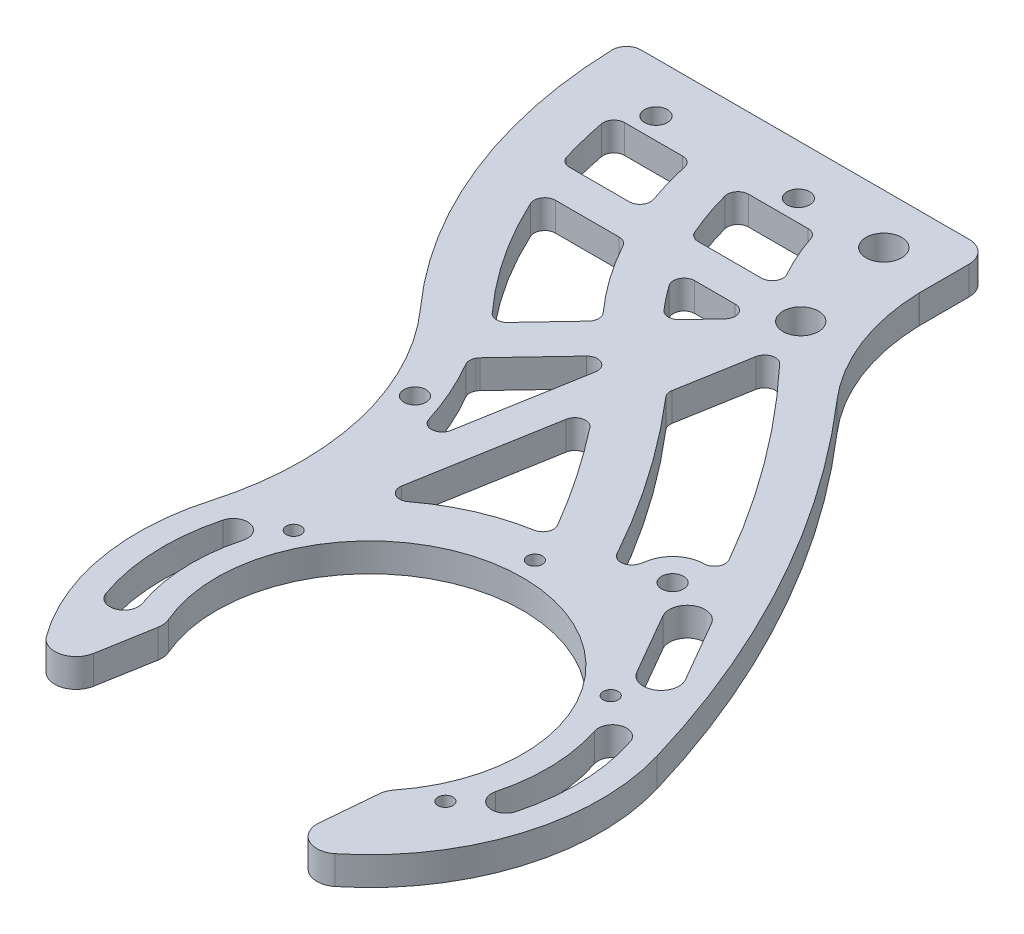
from build123d import *

# Parameters (mm, degrees)
SKETCH_1_W           = 52
SKETCH_1_H           = 10
EXTRUDE_1_DEPTH      = 4
SKETCH_2_R           = 1.6
CUT_EXTRUDE_1_DEPTH  = 4
EXTRUDE_3_DEPTH      = 4
SKETCH_4_R           = 21.5
CUT_EXTRUDE_2_DEPTH  = 4
SKETCH_5_R           = 1.05
CUT_EXTRUDE_3_DEPTH  = 4
CUT_EXTRUDE_4_DEPTH  = 10
CUT_EXTRUDE_5_DEPTH  = 10
CUT_EXTRUDE_6_DEPTH  = 10
EXTRUDE_START        = -4
SKETCH_11_R          = 4.5
EXTRUDE_4_DEPTH      = 4
SKETCH_12_R          = 1.55
CUT_EXTRUDE_7_DEPTH  = 4
CUT_EXTRUDE_9_DEPTH  = 10
FILLET_5_R           = 3
SKETCH_15_R          = 1.55
CUT_EXTRUDE_10_DEPTH = 10
CUT_EXTRUDE_11_DEPTH = 4
FILLET_6_R           = 1.5
SKETCH_18_R          = 2.5
SKETCH_18_R_2        = 1.6
CUT_EXTRUDE_12_DEPTH = 4
CUT_EXTRUDE_START    = -4
CUT_EXTRUDE_13_DEPTH = 4
FILLET_7_R           = 2


# Read off the part's stored shape, not the designer's step: 切除-拉伸13
with BuildPart() as part:
    # 草图1 → 凸台-拉伸1 (new body)
    with BuildSketch(Plane(origin=(0, 0, 0), x_dir=(1, 0, 0), z_dir=(0, 1, 0))):
        Rectangle(SKETCH_1_W, SKETCH_1_H)
    extrude(amount=EXTRUDE_1_DEPTH)

    # 草图2 → 切除-拉伸1 (cut)
    with BuildSketch(Plane(origin=(0, 4, 0), x_dir=(1, 0, 0), z_dir=(0, 1, 0))):
        with Locations(Location((-14, -2, 0), (0, 0, 270))):
            Circle(SKETCH_2_R)
        with Locations(Location((6, -2, 0), (0, 0, 270))):
            Circle(SKETCH_2_R)
    extrude(amount=-CUT_EXTRUDE_1_DEPTH, mode=Mode.SUBTRACT)

    # 草图3 → 凸台-拉伸3 (add)
    with BuildSketch(Plane(origin=(0, 4, 0), x_dir=(1, 0, 0), z_dir=(0, 1, 0))):
        with BuildLine():
            ThreePointArc((1.521813045, -80.036664835), (32.882226801, -121.499775209), (63.933346813, -79.804535446))
            ThreePointArc((63.933346813, -79.804535446), (51.636617213, -50.215459979), (33.335884345, -23.913252421))
            ThreePointArc((33.335884345, -23.913252421), (28.020789941, -15.095507245), (26, -5))
            Line((26, -5), (-26, -5))
            ThreePointArc((-26, -5), (-23.512302629, -22.658936218), (-12.646779094, -36.799907362))
            ThreePointArc((-12.646779094, -36.799907362), (1.078545586, -56.242035351), (1.521813045, -80.036664835))
        make_face()
    extrude(amount=-EXTRUDE_3_DEPTH)

    # 草图4 → 切除-拉伸2 (cut)
    with BuildSketch(Plane(origin=(0, 4, 0), x_dir=(1, 0, 0), z_dir=(0, 1, 0))):
        with Locations(Location((32.761349256, -89, 0), (0, 0, 270))):
            Circle(SKETCH_4_R)
    extrude(amount=-CUT_EXTRUDE_2_DEPTH, mode=Mode.SUBTRACT)

    # 草图5 → 切除-拉伸3 (cut)
    with BuildSketch(Plane.XZ):
        with Locations(Location((31.515544041, 64.531694596, 0), (0, 0, 270))):
            Circle(SKETCH_5_R)
        with Locations(Location((10.948272581, 77.844746262, 0), (0, 0, 270))):
            Circle(SKETCH_5_R)
        with Locations(Location((12.194077796, 102.313051667, 0), (0, 0, 270))):
            Circle(SKETCH_5_R)
        with Locations(Location((34.007154472, 113.468305404, 0), (0, 0, 270))):
            Circle(SKETCH_5_R)
        with Locations(Location((54.574425932, 100.155253738, 0), (0, 0, 270))):
            Circle(SKETCH_5_R)
        with Locations(Location((53.328620717, 75.686948333, 0), (0, 0, 270))):
            Circle(SKETCH_5_R)
    extrude(amount=-CUT_EXTRUDE_3_DEPTH, mode=Mode.SUBTRACT)

    # 草图8 → 切除-拉伸4 (cut)
    with BuildSketch(Plane(origin=(0, 4, 0), x_dir=(1, 0, 0), z_dir=(0, 1, 0))):
        with BuildLine():
            Line((45.98329313, -118.688890181), (48.203895401, -103.959203474))
            ThreePointArc((48.203895401, -103.959203474), (29.304772302, -110.220322235), (13.369657115, -98.285056591))
            Line((13.369657115, -98.285056591), (10.800862536, -112.958026275))
            ThreePointArc((10.800862536, -112.958026275), (27.53629107, -121.077231286), (45.98329313, -118.688890181))
        make_face()
    extrude(amount=-CUT_EXTRUDE_4_DEPTH, mode=Mode.SUBTRACT)

    # 草图9 → 切除-拉伸5 (cut)
    with BuildSketch(Plane(origin=(0, 4, 0), x_dir=(1, 0, 0), z_dir=(0, 1, 0))):
        with BuildLine():
            ThreePointArc((2.261304319, -44.591253126), (6.28220686, -52.93399338), (8.570902162, -61.907891418))
            Line((8.570902162, -61.907891418), (13.726418113, -32.459554104))
            Line((13.726418113, -32.459554104), (2.261304319, -44.591253126))
        make_face()
        with BuildLine():
            ThreePointArc((-4.036224589, -12.304585463), (-5.165941762, -8.688618892), (-6.029403289, -5))
            Line((-6.029403289, -5), (-17.20128616, -5))
            ThreePointArc((-17.20128616, -5), (-16.390165734, -9.150885172), (-15.302367858, -13.237994154))
            ThreePointArc((-15.302367858, -13.237994154), (-14.76064503, -14.008197341), (-13.866597194, -14.303756198))
            Line((-13.866597194, -14.303756198), (-5.450731068, -14.303756198))
            ThreePointArc((-5.450731068, -14.303756198), (-4.226240132, -13.67014061), (-4.036224589, -12.304585463))
        make_face()
        with BuildLine():
            ThreePointArc((13.136599911, -14.303756198), (13.910931188, -14.088439455), (14.462960482, -13.504304294))
            ThreePointArc((14.462960482, -13.504304294), (14.636495421, -12.786051458), (14.446054709, -12.072094984))
            ThreePointArc((14.446054709, -12.072094984), (12.758027899, -8.618194999), (11.458980338, -5))
            Line((11.458980338, -5), (0.100111359, -5))
            ThreePointArc((0.100111359, -5), (1.268714012, -9.267958013), (2.841998417, -13.403882811))
            ThreePointArc((2.841998417, -13.403882811), (3.395189817, -14.05878407), (4.21671586, -14.303756198))
            Line((4.21671586, -14.303756198), (13.136599911, -14.303756198))
        make_face()
        with BuildLine():
            ThreePointArc((29.973452999, -60.636685059), (23.981149414, -50.992543614), (17.145000635, -41.926991433))
            Line((17.145000635, -41.926991433), (12.394033631, -69.064542789))
            ThreePointArc((12.394033631, -69.064542789), (20.440709832, -63.300742342), (29.973452999, -60.636685059))
        make_face()
        with BuildLine():
            ThreePointArc((35.754959969, -56.638166076), (38.556099012, -57.020774317), (41.313388497, -57.645373151))
            Line((41.313388497, -57.645373151), (46.097332926, -52.594274703))
            ThreePointArc((46.097332926, -52.594274703), (35.503275522, -36.166992281), (22.782062805, -21.325819581))
            Line((22.782062805, -21.325819581), (20.398205396, -34.942427066))
            ThreePointArc((20.398205396, -34.942427066), (28.619942986, -45.405693363), (35.754959969, -56.638166076))
        make_face()
        with BuildLine():
            ThreePointArc((15.512644471, -21.834042827), (15.80003242, -20.21022016), (14.422456661, -19.303756198))
            Line((14.422456661, -19.303756198), (8.745122175, -19.303756198))
            ThreePointArc((8.745122175, -19.303756198), (7.411952212, -20.116255035), (7.523047642, -21.673545732))
            ThreePointArc((7.523047642, -21.673545732), (8.814595067, -23.40099417), (10.185698616, -25.06600105))
            ThreePointArc((10.185698616, -25.06600105), (10.740014236, -25.468525591), (11.415497527, -25.582605109))
            ThreePointArc((11.415497527, -25.582605109), (11.95762664, -25.443763133), (12.411135384, -25.115874602))
            Line((12.411135384, -25.115874602), (15.512644471, -21.834042827))
        make_face()
        with BuildLine():
            ThreePointArc((-1.506377954, -37.498903628), (-0.411648069, -37.986972344), (0.691104569, -37.5173116))
            Line((0.691104569, -37.5173116), (6.202954756, -31.685000754))
            ThreePointArc((6.202954756, -31.685000754), (6.612622783, -30.675510032), (6.231100583, -29.655049243))
            ThreePointArc((6.231100583, -29.655049243), (2.568643561, -25.059607296), (-0.551939961, -20.080286398))
            ThreePointArc((-0.551939961, -20.080286398), (-1.102788408, -19.512399411), (-1.865938229, -19.303756198))
            Line((-1.865938229, -19.303756198), (-10.824870498, -19.303756198))
            ThreePointArc((-10.824870498, -19.303756198), (-12.088603037, -19.995684376), (-12.186452705, -21.433116105))
            ThreePointArc((-12.186452705, -21.433116105), (-7.465018486, -29.877239502), (-1.506377954, -37.498903628))
        make_face()
    extrude(amount=-CUT_EXTRUDE_5_DEPTH, mode=Mode.SUBTRACT)

    # 草图10 → 切除-拉伸6 (cut)
    with BuildSketch(Plane(origin=(0, 4, 0), x_dir=(1, 0, 0), z_dir=(0, 1, 0))):
        with BuildLine():
            ThreePointArc((-26, -5), (-21.816679344, -21.010216482), (-14.074474337, -35.635040075))
            ThreePointArc((-14.074474337, -35.635040075), (-23.857818501, -21.80478562), (-26, -5))
        make_face()
    extrude(amount=-CUT_EXTRUDE_6_DEPTH, mode=Mode.SUBTRACT)

    # 草图11 → 凸台-拉伸4 (add)
    with BuildSketch(Plane(origin=(0, 4, 0), x_dir=(1, 0, 0), z_dir=(0, 1, 0)).offset(EXTRUDE_START)):
        with Locations((43.923502836, -57.591644213)):
            Circle(SKETCH_11_R)
        with BuildLine():
            Line((12.488002369, -103.321073663), (12.812973446, -101.464836968))
            ThreePointArc((12.812973446, -101.464836968), (11.159808075, -102.131982223), (12.488002369, -103.321073663))
        make_face()
    extrude(amount=EXTRUDE_4_DEPTH)

    # 草图12 → 切除-拉伸7 (cut)
    with BuildSketch(Plane(origin=(0, 4, 0), x_dir=(1, 0, 0), z_dir=(0, 1, 0))):
        with Locations(Location((43.923502836, -57.591644213, 0), (0, 0, 270))):
            Circle(SKETCH_12_R)
    extrude(amount=-CUT_EXTRUDE_7_DEPTH, mode=Mode.SUBTRACT)

    # 草图14 → 切除-拉伸9 (cut)
    with BuildSketch(Plane(origin=(0, 4, 0), x_dir=(1, 0, 0), z_dir=(0, 1, 0))):
        with BuildLine():
            Line((47.77758134, -117.822955678), (49.091476898, -102.984882238))
            ThreePointArc((49.091476898, -102.984882238), (48.655153878, -103.478845764), (48.203895401, -103.959203474))
            Line((48.203895401, -103.959203474), (45.98329313, -118.688890181))
            ThreePointArc((45.98329313, -118.688890181), (46.887074229, -118.269675331), (47.77758134, -117.822955678))
        make_face()
    extrude(amount=-CUT_EXTRUDE_9_DEPTH, mode=Mode.SUBTRACT)

    # 圆角5
    fillet_5_edges = [part.edges().sort_by_distance(p)[0] for p in [
        (-14.074474337, 2, 35.635040075),
        (49.091476898, 2, 102.984882238),
        (47.77758134, 2, 117.822955678),
        (26, 2, 5),
        (-26, 2, 5),
        (-26, 2, -5),
        (26, 2, -5),
        (13.369657115, 2, 98.285056591),
        (10.800862536, 2, 112.958026275),
    ]]
    fillet(fillet_5_edges, radius=FILLET_5_R)

    # 草图15 → 切除-拉伸10 (cut)
    with BuildSketch(Plane(origin=(0, 4, 0), x_dir=(1, 0, 0), z_dir=(0, 1, 0))):
        with Locations(Location((3.122228964, -52.979654288, 0), (0, 0, 270))):
            Circle(SKETCH_15_R)
    extrude(amount=-CUT_EXTRUDE_10_DEPTH, mode=Mode.SUBTRACT)

    # 草图17 → 切除-拉伸11 (cut)
    with BuildSketch(Plane(origin=(0, 4, 0), x_dir=(1, 0, 0), z_dir=(0, 1, 0))):
        with BuildLine():
            Line((47.299544417, -62.334301422), (52.299544417, -70.99455546))
            ThreePointArc((52.299544417, -70.99455546), (55.714607926, -71.909618969), (56.629671436, -68.49455546))
            Line((56.629671436, -68.49455546), (51.629671436, -59.834301422))
            ThreePointArc((51.629671436, -59.834301422), (48.214607926, -58.919237913), (47.299544417, -62.334301422))
        make_face()
        with BuildLine():
            Line((39.44111887, -57.193857859), (38.127043054, -61.009656485))
            ThreePointArc((38.127043054, -61.009656485), (36.961437554, -58.812822159), (35.754959969, -56.638166076))
            ThreePointArc((35.754959969, -56.638166076), (37.606013339, -56.863117296), (39.44111887, -57.193857859))
        make_face()
        with BuildLine():
            ThreePointArc((47.059341861, -54.364181803), (46.282476668, -53.759511326), (45.39271321, -53.338243118))
            Line((45.39271321, -53.338243118), (46.097332926, -52.594274703))
            ThreePointArc((46.097332926, -52.594274703), (46.581432397, -53.477546007), (47.059341861, -54.364181803))
        make_face()
    extrude(amount=-CUT_EXTRUDE_11_DEPTH, mode=Mode.SUBTRACT)

    # 圆角6
    fillet_6_edges = [part.edges().sort_by_distance(p)[0] for p in [
        (0.100111359, 2, 5),
        (11.458980338, 2, 5),
        (-6.029403289, 2, 5),
        (-17.20128616, 2, 5),
        (12.394033631, 2, 69.064542789),
        (17.145000635, 2, 41.926991433),
        (29.973452999, 2, 60.636685059),
        (8.570902162, 2, 61.907891418),
        (2.261304319, 2, 44.591253126),
        (13.726418113, 2, 32.459554104),
        (20.398205396, 2, 34.942427066),
        (22.782062805, 2, 21.325819581),
        (39.44111887, 2, 57.193857859),
        (47.059341861, 2, 54.364181803),
        (38.127043054, 2, 61.009656485),
    ]]
    fillet(fillet_6_edges, radius=FILLET_6_R)

    # 草图18 → 切除-拉伸12 (cut)
    with BuildSketch(Plane(origin=(0, 4, 0), x_dir=(1, 0, 0), z_dir=(0, 1, 0))):
        with Locations(Location((18, -2, 0), (0, 0, 270))):
            Circle(SKETCH_18_R)
        with Locations(Location((21.136599911, -16.803756198, 0), (0, 0, 270))):
            Circle(SKETCH_18_R)
        with Locations(Location((6, -2, 0), (0, 0, 270))):
            Circle(SKETCH_18_R_2)
        with BuildLine():
            ThreePointArc((4.73796843, -81.537418203), (3.78549795, -90.183233304), (5.439728086, -98.722603388))
            ThreePointArc((5.439728086, -98.722603388), (7.994502194, -99.936328752), (9.208227558, -97.381554645))
            ThreePointArc((9.208227558, -97.381554645), (7.782167095, -90.02002871), (8.603262337, -82.56673983))
            ThreePointArc((8.603262337, -82.56673983), (7.185276197, -80.119432063), (4.73796843, -81.537418203))
        make_face()
        with BuildLine():
            ThreePointArc((60.784730082, -96.462581797), (61.748600489, -88.140194236), (60.293149381, -79.889567415))
            ThreePointArc((60.293149381, -79.889567415), (57.76609885, -78.619128274), (56.495659709, -81.146178806))
            ThreePointArc((56.495659709, -81.146178806), (57.75035894, -88.258788135), (56.919436175, -95.43326017))
            ThreePointArc((56.919436175, -95.43326017), (58.337422315, -97.880567937), (60.784730082, -96.462581797))
        make_face()
    extrude(amount=-CUT_EXTRUDE_12_DEPTH, mode=Mode.SUBTRACT)

    # 切除-拉伸13 outline → 切除-拉伸13 (cut)
    with BuildSketch(Plane(origin=(0, 4, 0), x_dir=(1, 0, 0), z_dir=(0, 1, 0)).offset(CUT_EXTRUDE_START)):
        with BuildLine():
            ThreePointArc((-12.646779619, -36.799906956), (-9.833941896, -39.186349614), (-7.249774204, -41.818694949))
            ThreePointArc((-7.249774204, -41.818694949), (-20.363813597, -20.487270806), (-25.15128429, 4.090927044))
            ThreePointArc((-25.15128429, 4.090927044), (-25.779734958, 3.128305617), (-26, 2))
            Line((-26, 2), (-26, -4.787512325))
            ThreePointArc((-26, -4.787512325), (-25.992340011, -5.001758122), (-25.969399159, -5.214909838))
            ThreePointArc((-25.969399159, -5.214909838), (-21.851695099, -20.92008608), (-14.306127818, -35.296193409))
            ThreePointArc((-14.306127818, -35.296193409), (-14.05130657, -35.620735597), (-13.754363003, -35.907242174))
            ThreePointArc((-13.754363003, -35.907242174), (-13.205106931, -36.359202184), (-12.646779619, -36.799906956))
        make_face()
    extrude(amount=CUT_EXTRUDE_13_DEPTH, mode=Mode.SUBTRACT)

    # 圆角7
    fillet_7_edges = [part.edges().sort_by_distance(p)[0] for p in [
        (-25.15128429, 2, -4.090927044),
    ]]
    fillet(fillet_7_edges, radius=FILLET_7_R)


solid = part.part
